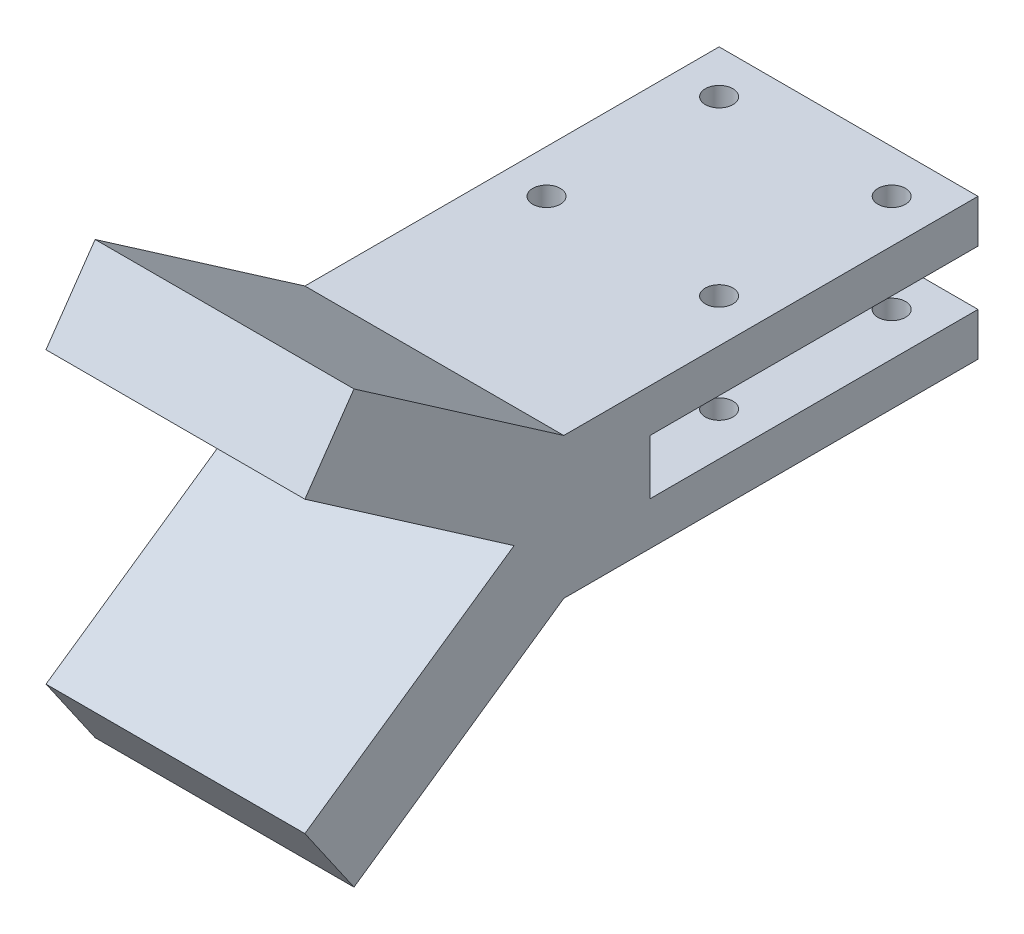
from build123d import *

# Parameters (mm, degrees)
BOSS_EXTRUDE1_DEPTH  = 30
M3_CLEARANCE_HOLE1_D = 3.2


with BuildPart() as part:
    # Sketch1 → Boss-Extrude1 (new body)
    with BuildSketch(Plane(origin=(0, 0, 0), x_dir=(0, 0, -1), z_dir=(1, 0, 0))):
        Polygon((0, -3.175), (38, -3.175), (38, -8.175), (-10, -8.175), (-34.308863667, -25), (-40, -16.77741116), (-15.759892983, 0), (-40, 16.77741116), (-34.308863667, 25), (-10, 8.175), (38, 8.175), (38, 3.175), (0, 3.175), align=None)
    extrude(amount=BOSS_EXTRUDE1_DEPTH)

    # M3 Clearance Hole1 (through all)
    with Locations(Plane(origin=(0, 8.175, 0), x_dir=(1, 0, 0), z_dir=(0, 1, 0))):
        with Locations((5, 33), (25, 33), (25, 13), (5, 13)):
            Hole(M3_CLEARANCE_HOLE1_D / 2)


solid = part.part
